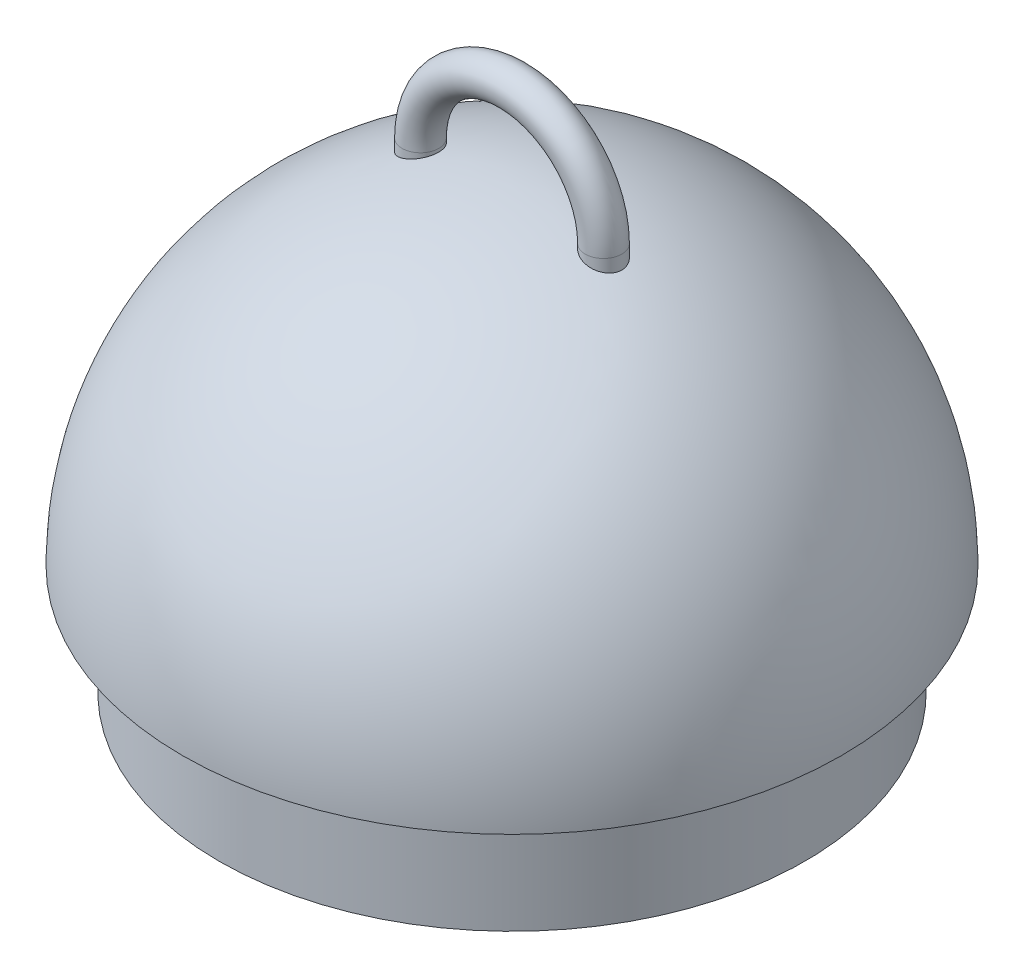
from build123d import *

# Parameters (mm, degrees)
SKETCH1_R          = 80
CASE_MATE_DEPTH    = 30
CIRCULAR_CAP_ANGLE = 180
SKETCH3_R          = 5
RING_BASE_DEPTH    = 118.618
SKETCH4_R          = 5
RING_REVOLVE_ANGLE = 180


with BuildPart() as part:
    # Sketch1 → Case Mate (new body)
    with BuildSketch(Plane(origin=(0, 0, 0), x_dir=(1, 0, 0), z_dir=(0, 1, 0))):
        Circle(SKETCH1_R)
    extrude(amount=CASE_MATE_DEPTH)

    # Sketch2 → Circular Cap (revolve)
    with BuildSketch(Plane(origin=(0, 30, 0), x_dir=(1, 0, 0), z_dir=(0, 1, 0))):
        with BuildLine():
            Line((90, 0), (-90, 0))
            ThreePointArc((-90, 0), (0, 90), (90, 0))
        make_face()
    revolve(axis=Axis((90, 30, 0), (1, 0, 0)), revolution_arc=CIRCULAR_CAP_ANGLE)

    # Sketch3 → Ring Base (add)
    with BuildSketch(Plane(origin=(0, 0, 0), x_dir=(-1, 0, 0), z_dir=(0, -1, 0))):
        with Locations((25, 0)):
            Circle(SKETCH3_R)
        with Locations((-25, 0)):
            Circle(SKETCH3_R)
    extrude(amount=-RING_BASE_DEPTH)

    # Sketch4 → Ring Revolve (revolve)
    with BuildSketch(Plane(origin=(0, 118.618, 0), x_dir=(1, 0, 0), z_dir=(0, 1, 0))):
        with Locations((-25, 0)):
            Circle(SKETCH4_R)
    revolve(axis=Axis((0, 118.618, 0), (0, 0, -1)), revolution_arc=RING_REVOLVE_ANGLE)


solid = part.part
